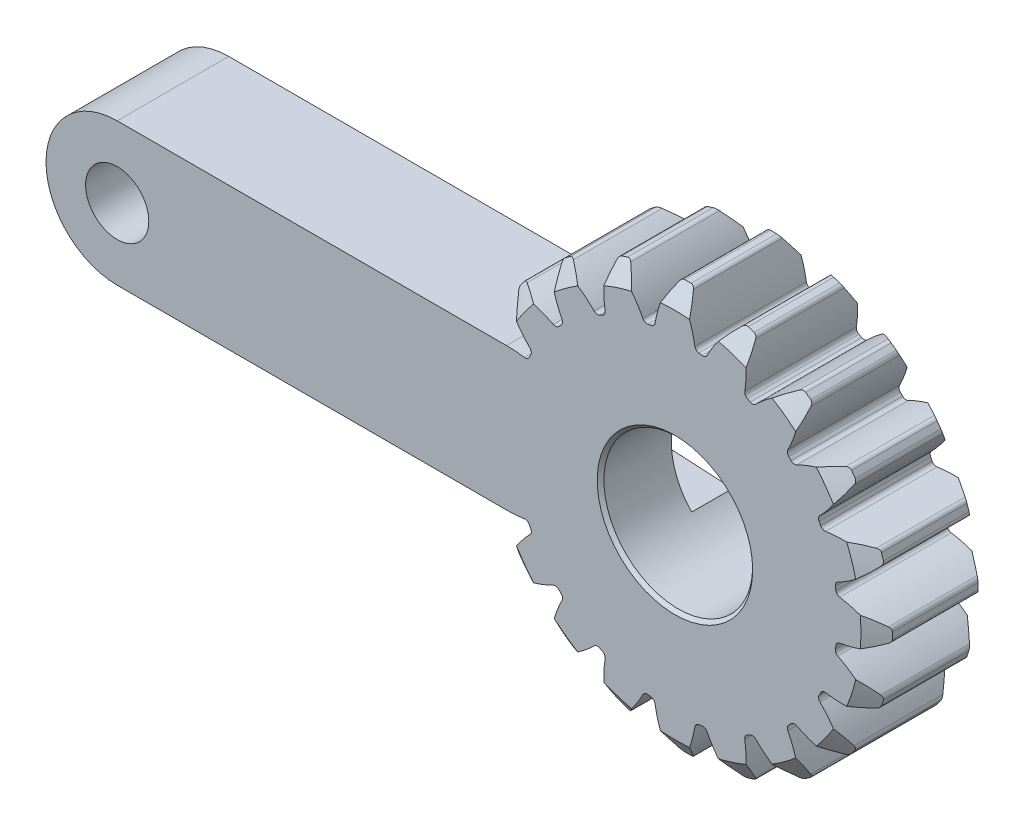
from build123d import *

# Parameters (mm, degrees)
SKETCH_11_R                            = 8.75
EXTRUDE_A_DEPTH                        = 6
EXTRUDE_START                          = -6
EXTRUDE_B_DEPTH                        = 6
FILLET_1139_R                          = 0.25
PATTERN_CIRCULAR_1464_COUNT            = 20
FILLET_1139_OF_PATTERN_CIRCULAR_1464_R = 0.25
SKETCH_4_R                             = 12
SKETCH_4_R_2                           = 10
CUT_EXTRUDE_6200_DEPTH                 = 1
CUT_EXTRUDE_6200_DRAFT                 = -55
CUT_EXTRUDE_START                      = -6
SKETCH_4_2_R                           = 12
SKETCH_4_2_R_2                         = 10
CUT_EXTRUDE_2_DEPTH                    = 1
CUT_EXTRUDE_2_DRAFT                    = 55
SKETCH_13_R                            = 4
CUT_EXTRUDE_4_DEPTH                    = 17.673332168
CHAMFER_1_SIZE                         = 0.18
SKETCH_15_R                            = 1.7
EXTRUDE_1_DEPTH                        = 6
CUT_EXTRUDE_START_2                    = -2.2
CUT_EXTRUDE_5_DEPTH                    = 2.2


with BuildPart() as part:
    # 草图11 → 拉伸-齿轮a (new body)
    with BuildSketch(Plane(origin=(-11.8785, -4, 0), x_dir=(1, 0, 0), z_dir=(0, 0, 1))):
        with Locations((11.8785, 4)):
            Circle(SKETCH_11_R)
    extrude(amount=-EXTRUDE_A_DEPTH)

    # 草图3 → 拉伸-齿轮b (add)
    with BuildSketch(Plane(origin=(-1.36106, -4, 0), x_dir=(1, 0, 0), z_dir=(0, 0, 1)).offset(EXTRUDE_START)):
        with BuildLine():
            ThreePointArc((10.042063636, 2.903334206), (10.11106, 4), (10.042063636, 5.096665794))
            ThreePointArc((10.042063636, 5.096665794), (11.237023581, 4.81690867), (12.356574121, 4.314116559))
            ThreePointArc((12.356574121, 4.314116559), (12.36106, 4), (12.356574121, 3.685883441))
            ThreePointArc((12.356574121, 3.685883441), (11.237023581, 3.18309133), (10.042063636, 2.903334206))
        make_face()
    extrude_b = extrude(amount=EXTRUDE_B_DEPTH)

    # Fillet 1139
    fillet_1139_edges = [part.edges().sort_by_distance(p)[0] for p in [
        (10.995514121, -0.314116559, -3),
        (8.681003637, -1.096665794, -3),
        (8.681003637, 1.096665794, -3),
        (10.995514121, 0.314116559, -3),
    ]]
    fillet(fillet_1139_edges, radius=FILLET_1139_R)

    # Pattern Circular 1464: 拉伸-齿轮b ×20 about axis
    pattern_circular_1464_axis = Axis((0, 0, 0), (0, 0, 1))
    for i in range(1, PATTERN_CIRCULAR_1464_COUNT):
        add(extrude_b.rotate(pattern_circular_1464_axis, i * 360 / PATTERN_CIRCULAR_1464_COUNT))

    # Fillet 1139 of Pattern Circular 1464
    fillet_1139_of_pattern_circular_1464_edges = [part.edges().sort_by_distance(p)[0] for p in [
        (10.55442271, 3.099058125, -3),
        (8.595013444, 1.639586503, -3),
        (7.917236709, 3.725568801, -3),
        (10.360288, 3.696543325, -3),
        (9.080190867, 6.208875408, -3),
        (7.66768345, 4.215344648, -3),
        (6.37847549, 5.989787177, -3),
        (8.710924705, 6.717126676, -3),
        (6.717126676, 8.710924705, -3),
        (5.989787177, 6.37847549, -3),
        (4.215344648, 7.66768345, -3),
        (6.208875408, 9.080190867, -3),
        (3.696543325, 10.360288, -3),
        (3.725568801, 7.917236709, -3),
        (1.639586503, 8.595013444, -3),
        (3.099058125, 10.55442271, -3),
        (0.314116559, 10.995514121, -3),
        (1.096665794, 8.681003637, -3),
        (-1.096665794, 8.681003637, -3),
        (-0.314116559, 10.995514121, -3),
        (-3.099058125, 10.55442271, -3),
        (-1.639586503, 8.595013444, -3),
        (-3.725568801, 7.917236709, -3),
        (-3.696543325, 10.360288, -3),
        (-6.208875408, 9.080190867, -3),
        (-4.215344648, 7.66768345, -3),
        (-5.989787177, 6.37847549, -3),
        (-6.717126676, 8.710924705, -3),
        (-8.710924705, 6.717126676, -3),
        (-6.37847549, 5.989787177, -3),
        (-7.66768345, 4.215344648, -3),
        (-9.080190867, 6.208875408, -3),
        (-10.360288, 3.696543325, -3),
        (-7.917236709, 3.725568801, -3),
        (-8.595013444, 1.639586503, -3),
        (-10.55442271, 3.099058125, -3),
        (-10.995514121, 0.314116559, -3),
        (-8.681003637, 1.096665794, -3),
        (-8.681003637, -1.096665794, -3),
        (-10.995514121, -0.314116559, -3),
        (-10.55442271, -3.099058125, -3),
        (-8.595013444, -1.639586503, -3),
        (-7.917236709, -3.725568801, -3),
        (-10.360288, -3.696543325, -3),
        (-9.080190867, -6.208875408, -3),
        (-7.66768345, -4.215344648, -3),
        (-6.37847549, -5.989787177, -3),
        (-8.710924705, -6.717126676, -3),
        (-6.717126676, -8.710924705, -3),
        (-5.989787177, -6.37847549, -3),
        (-4.215344648, -7.66768345, -3),
        (-6.208875408, -9.080190867, -3),
        (-3.696543325, -10.360288, -3),
        (-3.725568801, -7.917236709, -3),
        (-1.639586503, -8.595013444, -3),
        (-3.099058125, -10.55442271, -3),
        (-0.314116559, -10.995514121, -3),
        (-1.096665794, -8.681003637, -3),
        (1.096665794, -8.681003637, -3),
        (0.314116559, -10.995514121, -3),
        (3.099058125, -10.55442271, -3),
        (1.639586503, -8.595013444, -3),
        (3.725568801, -7.917236709, -3),
        (3.696543325, -10.360288, -3),
        (6.208875408, -9.080190867, -3),
        (4.215344648, -7.66768345, -3),
        (5.989787177, -6.37847549, -3),
        (6.717126676, -8.710924705, -3),
        (8.710924705, -6.717126676, -3),
        (6.37847549, -5.989787177, -3),
        (7.66768345, -4.215344648, -3),
        (9.080190867, -6.208875408, -3),
        (10.360288, -3.696543325, -3),
        (7.917236709, -3.725568801, -3),
        (8.595013444, -1.639586503, -3),
        (10.55442271, -3.099058125, -3),
    ]]
    fillet(fillet_1139_of_pattern_circular_1464_edges, radius=FILLET_1139_OF_PATTERN_CIRCULAR_1464_R)


with BuildPart() as cut_extrude_6200_tool:
    # 草图4 → Cut-Extrude 6200 (with draft: the straight prism first)
    with BuildSketch(Plane(origin=(0, 0, -6), x_dir=(-1, 0, 0), z_dir=(0, 0, -1))):
        Circle(SKETCH_4_R)
        Circle(SKETCH_4_R_2, mode=Mode.SUBTRACT)
    extrude(amount=-CUT_EXTRUDE_6200_DEPTH)
    # Cut-Extrude 6200: the draft: its side faces are tilted about the plane it starts from
    cut_extrude_6200_sides = [cut_extrude_6200_tool.faces().sort_by_distance(p)[0] for p in [
        (12, 0, -5.5),
        (10, 0, -5.5),
    ]]
    draft(cut_extrude_6200_sides, Plane(origin=(0, 0, -6), x_dir=(-1, 0, 0), z_dir=(0, 0, -1)), CUT_EXTRUDE_6200_DRAFT)


with BuildPart() as part_1:
    add(part.part)

    # Cut-Extrude 6200: cut by cut_extrude_6200_tool
    add(cut_extrude_6200_tool.part, mode=Mode.SUBTRACT)


with BuildPart() as cut_extrude_2_tool:
    # 草图4<2> → 切除-拉伸2 (with draft: the straight prism first)
    with BuildSketch(Plane(origin=(0, 0, -6), x_dir=(-1, 0, 0), z_dir=(0, 0, -1)).offset(CUT_EXTRUDE_START)):
        Circle(SKETCH_4_2_R)
        Circle(SKETCH_4_2_R_2, mode=Mode.SUBTRACT)
    extrude(amount=CUT_EXTRUDE_2_DEPTH)
    # 切除-拉伸2: the draft: its side faces are tilted about the plane it starts from
    cut_extrude_2_sides = [cut_extrude_2_tool.faces().sort_by_distance(p)[0] for p in [
        (12, 0, -0.5),
        (10, 0, -0.5),
    ]]
    draft(cut_extrude_2_sides, Plane(origin=(0, 0, -6), x_dir=(-1, 0, 0), z_dir=(0, 0, -1)).offset(CUT_EXTRUDE_START), CUT_EXTRUDE_2_DRAFT)


with BuildPart() as part_2:
    add(part_1.part)

    # 切除-拉伸2: cut by cut_extrude_2_tool
    add(cut_extrude_2_tool.part, mode=Mode.SUBTRACT)

    # 草图13 → 切除-拉伸4 (cut, through all)
    with BuildSketch(Plane.XY):
        Circle(SKETCH_13_R)
    extrude(amount=-CUT_EXTRUDE_4_DEPTH, mode=Mode.SUBTRACT)

    # 倒角1
    chamfer_1_edges = [part_2.edges().sort_by_distance(p)[0] for p in [
        (-4, 0, -6),
        (-4, 0, 0),
    ]]
    chamfer(chamfer_1_edges, length=CHAMFER_1_SIZE)

    # 草图15 → 凸台-拉伸1 (add)
    with BuildSketch(Plane.XY):
        with BuildLine():
            Line((-9.064159779, -3.829218358), (-30, -3.829218358))
            ThreePointArc((-30, -3.829218358), (-33.829218358, 0), (-30, 3.829218358))
            Line((-30, 3.829218358), (-9.064159779, 3.829218358))
            Line((-9.064159779, 3.829218358), (-4.658225455, 0.589192241))
            Line((-4.658225455, 0.589192241), (-9.064159779, -3.829218358))
        make_face()
        with Locations((-30, 0)):
            Circle(SKETCH_15_R, mode=Mode.SUBTRACT)
    extrude(amount=-EXTRUDE_1_DEPTH)

    # 草图16 → 切除-拉伸5 (cut)
    with BuildSketch(Plane(origin=(0, 0, -6), x_dir=(-1, 0, 0), z_dir=(0, 0, -1)).offset(CUT_EXTRUDE_START_2)):
        with BuildLine():
            ThreePointArc((2.90473751, 2.75), (4, 0), (2.90473751, -2.75))
            Line((2.90473751, -2.75), (15.11217247, -2.097001988))
            ThreePointArc((15.11217247, -2.097001988), (17.1, 0), (15.11217247, 2.097001988))
            Line((15.11217247, 2.097001988), (2.90473751, 2.75))
        make_face()
    extrude(amount=CUT_EXTRUDE_5_DEPTH, mode=Mode.SUBTRACT)


solid = part_2.part
